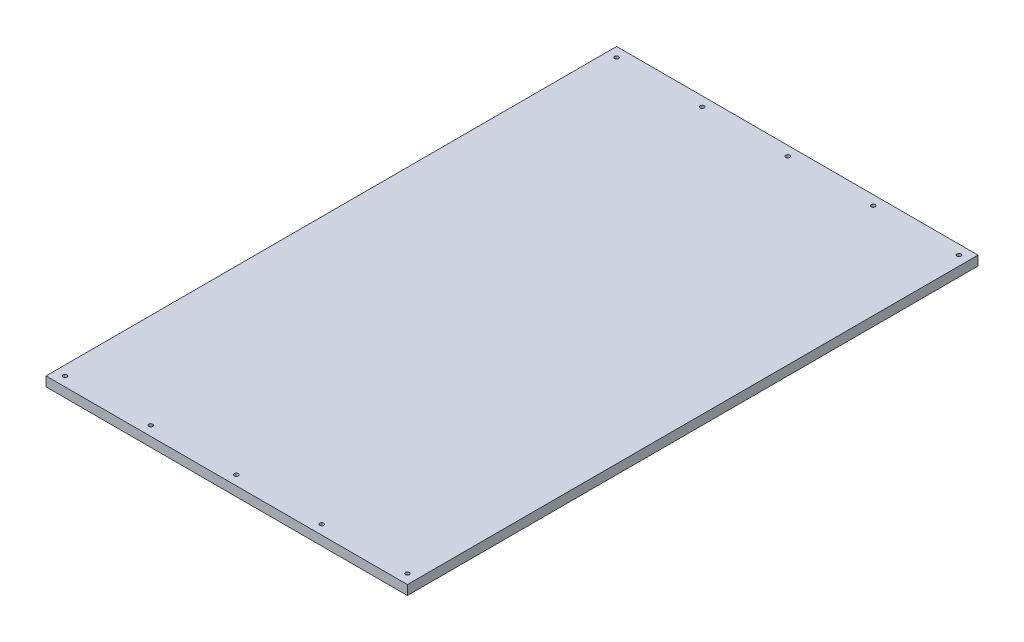
from build123d import *

# Parameters (mm, degrees)
SKETCH1_W           = 380
SKETCH1_H           = 600
BOSS_EXTRUDE1_DEPTH = 10
SKETCH2_R           = 2.1
CUT_EXTRUDE1_DEPTH  = 10


with BuildPart() as part:
    # Sketch1 → Boss-Extrude1 (new body)
    with BuildSketch(Plane(origin=(0, 0, 0), x_dir=(1, 0, 0), z_dir=(0, 1, 0))):
        Rectangle(SKETCH1_W, SKETCH1_H)
    extrude(amount=BOSS_EXTRUDE1_DEPTH)

    # Sketch2 → Cut-Extrude1 (cut)
    with BuildSketch(Plane(origin=(0, 10, 0), x_dir=(1, 0, 0), z_dir=(0, 1, 0))):
        with Locations((0, 290)):
            Circle(SKETCH2_R)
        with Locations((90, 290)):
            Circle(SKETCH2_R)
        with Locations((180, 290)):
            Circle(SKETCH2_R)
        with Locations((-90, 290)):
            Circle(SKETCH2_R)
        with Locations((-180, 290)):
            Circle(SKETCH2_R)
        with Locations((180, -290)):
            Circle(SKETCH2_R)
        with Locations((90, -290)):
            Circle(SKETCH2_R)
        with Locations((0, -290)):
            Circle(SKETCH2_R)
        with Locations((-90, -290)):
            Circle(SKETCH2_R)
        with Locations((-180, -290)):
            Circle(SKETCH2_R)
    extrude(amount=-CUT_EXTRUDE1_DEPTH, mode=Mode.SUBTRACT)


solid = part.part
